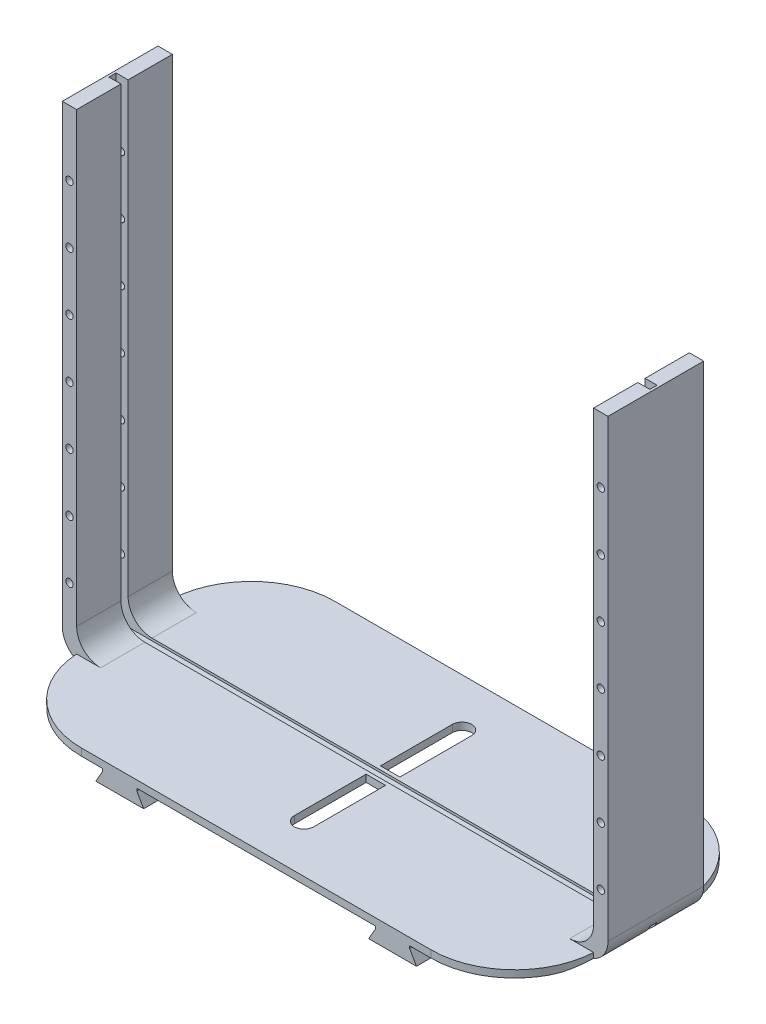
from build123d import *

# Parameters (mm, degrees)
SKETCH1_W           = 6
SKETCH1_H           = 197
SKETCH1_R           = 1.55
SKETCH1_H_2         = 3
BOSS_EXTRUDE1_DEPTH = 106
SKETCH2_W           = 6
SKETCH2_H           = 33
CUT_EXTRUDE1_DEPTH  = 234
FILLET2_R           = 10
SKETCH2_5_W         = 5
SKETCH2_5_H         = 3
SKETCH2_5_W_2       = 103.95
SKETCH2_5_W_3       = 8.1
CUT_EXTRUDE2_DEPTH  = 198
FILLET1_R           = 35


with BuildPart() as part:
    # Sketch1 → Boss-Extrude1 (new body)
    # profile 1 of 7: a face of its own
    with BuildSketch(Plane.XY):
        with Locations((225, 101.5)):
            Rectangle(SKETCH1_W, SKETCH1_H)
        with Locations((225, 27.25)):
            Circle(SKETCH1_R, mode=Mode.SUBTRACT)
        with Locations((225, 51.5)):
            Circle(SKETCH1_R, mode=Mode.SUBTRACT)
        with Locations((225, 75.75)):
            Circle(SKETCH1_R, mode=Mode.SUBTRACT)
        with Locations((225, 100)):
            Circle(SKETCH1_R, mode=Mode.SUBTRACT)
        with Locations((225, 124.25)):
            Circle(SKETCH1_R, mode=Mode.SUBTRACT)
        with Locations((225, 148.5)):
            Circle(SKETCH1_R, mode=Mode.SUBTRACT)
        with Locations((225, 172.75)):
            Circle(SKETCH1_R, mode=Mode.SUBTRACT)
    # profile 2 of 7: a face of its own
    with BuildSketch(Plane.XY):
        Polygon((178.113248654, -1), (178.113248654, 0), (163.886751346, 0), (163.886751346, -1), (161, -6), (181, -6), align=None)
    # profile 3 of 7: a face of its own
    with BuildSketch(Plane.XY):
        Polygon((64.113248654, 0), (49.886751346, 0), (49.886751346, -1), (47, -6), (67, -6), (64.113248654, -1), align=None)
    # profile 4 of 7: a face of its own
    with BuildSketch(Plane.XY):
        Polygon((222, 3), (6, 3), (6, 0), (49.886751346, 0), (64.113248654, 0), (163.886751346, 0), (178.113248654, 0), (222, 0), align=None)
    # profile 5 of 7: a face of its own
    with BuildSketch(Plane.XY):
        with Locations((225, 1.5)):
            Rectangle(SKETCH1_W, SKETCH1_H_2)
    # profile 6 of 7: a face of its own
    with BuildSketch(Plane.XY):
        with Locations((3, 1.5)):
            Rectangle(SKETCH1_W, SKETCH1_H_2)
    # profile 7 of 7: a face of its own
    with BuildSketch(Plane.XY):
        with Locations((3, 101.5)):
            Rectangle(SKETCH1_W, SKETCH1_H)
        with Locations((3, 27.25)):
            Circle(SKETCH1_R, mode=Mode.SUBTRACT)
        with Locations((3, 51.5)):
            Circle(SKETCH1_R, mode=Mode.SUBTRACT)
        with Locations((3, 75.75)):
            Circle(SKETCH1_R, mode=Mode.SUBTRACT)
        with Locations((3, 100)):
            Circle(SKETCH1_R, mode=Mode.SUBTRACT)
        with Locations((3, 124.25)):
            Circle(SKETCH1_R, mode=Mode.SUBTRACT)
        with Locations((3, 148.5)):
            Circle(SKETCH1_R, mode=Mode.SUBTRACT)
        with Locations((3, 172.75)):
            Circle(SKETCH1_R, mode=Mode.SUBTRACT)
    extrude(amount=BOSS_EXTRUDE1_DEPTH)

    # Sketch2 → Cut-Extrude1 (cut)
    with BuildSketch(Plane(origin=(0, 200, 0), x_dir=(1, 0, 0), z_dir=(0, 1, 0))):
        with BuildLine():
            Line((109.95, -20), (109.95, -50))
            Line((109.95, -50), (118.05, -50))
            Line((118.05, -50), (118.05, -20))
            ThreePointArc((118.05, -20), (114, -15.95), (109.95, -20))
        make_face()
        with BuildLine():
            Line((118.05, -56), (109.95, -56))
            Line((109.95, -56), (109.95, -86))
            ThreePointArc((109.95, -86), (114, -90.05), (118.05, -86))
            Line((118.05, -86), (118.05, -56))
        make_face()
        with Locations((225, -89.5)):
            Rectangle(SKETCH2_W, SKETCH2_H)
        with Locations((225, -16.5)):
            Rectangle(SKETCH2_W, SKETCH2_H)
        with Locations((3, -16.5)):
            Rectangle(SKETCH2_W, SKETCH2_H)
        with Locations((3, -89.5)):
            Rectangle(SKETCH2_W, SKETCH2_H)
    extrude(amount=-CUT_EXTRUDE1_DEPTH, mode=Mode.SUBTRACT)

    # Fillet2
    fillet2_edges = [part.edges().sort_by_distance(p)[0] for p in [
        (228, 0, 53),
        (222, 3, 53),
        (0, 0, 53),
        (6, 3, 53),
    ]]
    fillet(fillet2_edges, radius=FILLET2_R)

    # Sketch2<5> → Cut-Extrude2 (cut)
    with BuildSketch(Plane(origin=(0, 200, 0), x_dir=(1, 0, 0), z_dir=(0, 1, 0))):
        with Locations((224.5, -53)):
            Rectangle(SKETCH2_5_W, SKETCH2_5_H)
        with Locations((170.025, -53)):
            Rectangle(SKETCH2_5_W_2, SKETCH2_5_H)
        with Locations((57.975, -53)):
            Rectangle(SKETCH2_5_W_2, SKETCH2_5_H)
        with Locations((114, -53)):
            Rectangle(SKETCH2_5_W_3, SKETCH2_5_H)
        with Locations((3.5, -53)):
            Rectangle(SKETCH2_5_W, SKETCH2_5_H)
    extrude(amount=-CUT_EXTRUDE2_DEPTH, mode=Mode.SUBTRACT)

    # Fillet1
    # the kernel refuses this fillet: 35 mm, written as the material it takes off along each edge
    with BuildSketch(Plane(origin=(222, 90.357026048, 0), x_dir=(0, 0, 1), z_dir=(0, -1, 0))) as fillet1_piece_1:
        with BuildLine():
            CenterArc((35, 34.942810419), FILLET1_R, 180, 86.72417104)
            Line((0, 34.942810419), (-0.7, 34.942810419))
            Line((-0.7, 34.942810419), (-0.7, 0))
            Line((-0.7, 0), (0, -0.7))
            ThreePointArc((0, -0.7), (16.5, -0.7), (32.96, -0.698856208))
            Line((32.96, -0.698856208), (33, 0))
        make_face()
    extrude(amount=176.879203486, mode=Mode.SUBTRACT)
    with BuildSketch(Plane(origin=(6, 90.357026048, 0), x_dir=(1, 0, 0), z_dir=(0, -1, 0)), Plane(origin=(222, 90.357026048, 106), x_dir=(-1, 0, 0), z_dir=(0, -1, 0))) as fillet1_piece_2:
        with BuildLine():
            CenterArc((34.942810419, 35), FILLET1_R, 183.27582896, 86.72417104)
            Line((0, 33), (-0.698856208, 32.96))
            ThreePointArc((-0.698856208, 32.96), (-0.7, 16.5), (-0.7, 0))
            Line((-0.7, 0), (0, -0.7))
            Line((0, -0.7), (34.942810419, -0.7))
            Line((34.942810419, -0.7), (34.942810419, 0))
        make_face()
    extrude(amount=176.879203486, mode=Mode.SUBTRACT)
    with BuildSketch(Plane(origin=(6, 90.357026048, 106), x_dir=(1, 0, 0), z_dir=(0, -1, 0))) as fillet1_piece_3:
        with BuildLine():
            CenterArc((34.942810419, -35), FILLET1_R, 90, 86.72417104)
            Line((0, -33), (-0.698856208, -32.96))
            ThreePointArc((-0.698856208, -32.96), (-0.7, -16.5), (-0.7, 0))
            Line((-0.7, 0), (0, 0.7))
            Line((0, 0.7), (34.942810419, 0.7))
            Line((34.942810419, 0.7), (34.942810419, 0))
        make_face()
    extrude(amount=176.879203486, mode=Mode.SUBTRACT)


solid = part.part
